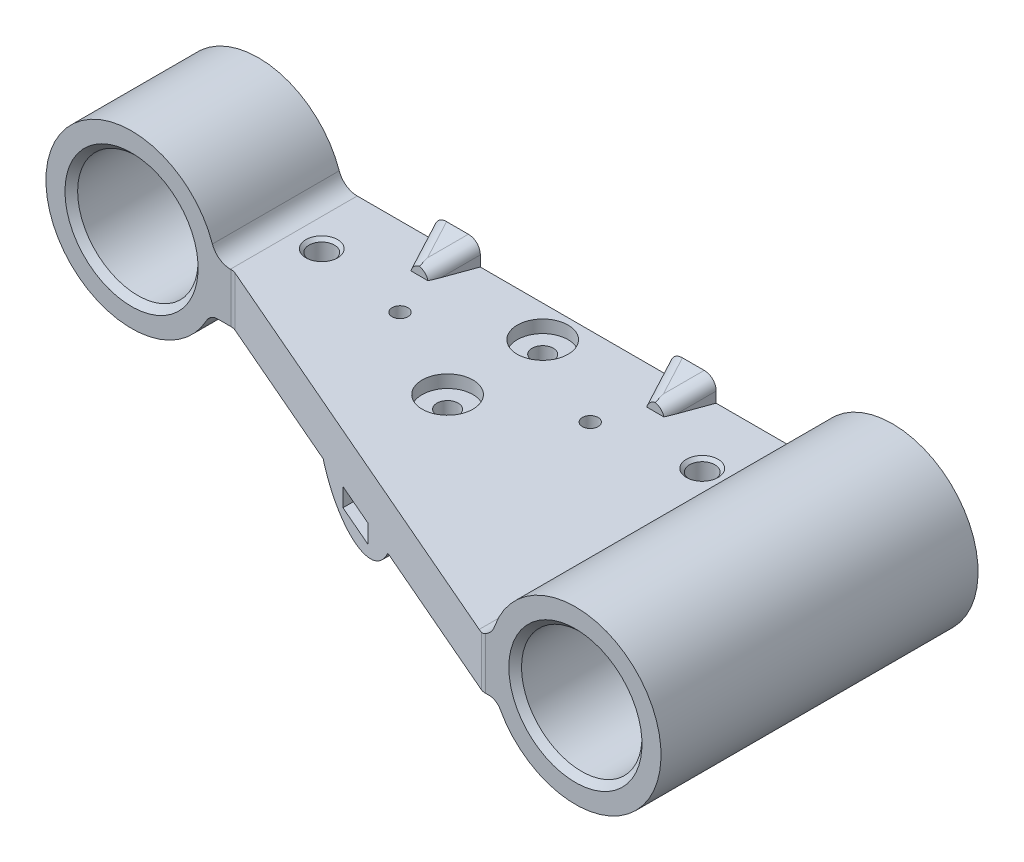
from build123d import *

# Parameters (mm, degrees)
SKETCH1_R                     = 9.5
SKETCH1_W                     = 7
SKETCH1_H                     = 1.9
BOSS_EXTRUDE1_DEPTH           = 50
SKETCH32_W                    = 32.172664372
SKETCH32_H                    = 50
SKETCH32_W_2                  = 30.763378825
BOSS_EXTRUDE4_DEPTH           = 3
SKETCH30_R                    = 1.675
SKETCH30_R_2                  = 1.25
CUT_EXTRUDE14_DEPTH           = 84.200435696
SKETCH31_R                    = 4
CUT_EXTRUDE15_DEPTH           = 2
CHAMFER1_SIZE                 = 1
SKETCH36_R                    = 2
CUT_EXTRUDE18_DEPTH           = 83.371475645
SKETCH37_R                    = 4
CUT_EXTRUDE19_DEPTH           = 2.8
SKETCH38_W                    = 7.194206864
SKETCH38_H                    = 7.080700956
BOSS_EXTRUDE6_DEPTH           = 6
BOSS_EXTRUDE6_DRAFT           = 20
BOSS_EXTRUDE6_PROFILE_2_DEPTH = 6
BOSS_EXTRUDE6_PROFILE_2_DRAFT = 20
FILLET2_R                     = 2
CHAMFER2_SIZE                 = 0.5
CUT_EXTRUDE20_START           = -10
SKETCH39_W                    = 33.713665857
SKETCH39_H                    = 35.884460507
CUT_EXTRUDE20_DEPTH           = 67.252868798
CUT_EXTRUDE21_DEPTH           = 83.371475645
CUT_EXTRUDE21_DEPTH_BACK      = 83.371475645
CHAMFER3_SIZE                 = 1
FILLET3_R                     = 2


with BuildPart() as part:
    # Sketch1 → Boss-Extrude1 (new body)
    with BuildSketch(Plane.XY):
        with BuildLine():
            Line((-34.408656248, 2.4), (34.408656248, 2.4))
            ThreePointArc((34.408656248, 2.4), (36.148562201, 2.95608362), (37.243446021, 4.418181818))
            ThreePointArc((37.243446021, 4.418181818), (52.24014746, 13.312841145), (63.5, 0))
            ThreePointArc((63.5, 0), (59.545941546, -9.545941546), (50, -13.5))
            ThreePointArc((50, -13.5), (42.170423209, -10.99762371), (37.243446021, -4.418181818))
            ThreePointArc((37.243446021, -4.418181818), (36.148562201, -2.95608362), (34.408656248, -2.4))
            Line((34.408656248, -2.4), (12.372954376, -2.4))
            ThreePointArc((12.372954376, -2.4), (10.729786704, -2.89001992), (9.623408959, -4.2))
            ThreePointArc((9.623408959, -4.2), (0, -10.5), (-9.623408959, -4.2))
            ThreePointArc((-9.623408959, -4.2), (-10.729786704, -2.89001992), (-12.372954376, -2.4))
            Line((-12.372954376, -2.4), (-34.408656248, -2.4))
            ThreePointArc((-34.408656248, -2.4), (-36.148562201, -2.95608362), (-37.243446021, -4.418181818))
            ThreePointArc((-37.243446021, -4.418181818), (-42.170423209, -10.99762371), (-50, -13.5))
            ThreePointArc((-50, -13.5), (-59.545941546, -9.545941546), (-63.5, 0))
            ThreePointArc((-63.5, 0), (-52.24014746, 13.312841145), (-37.243446021, 4.418181818))
            ThreePointArc((-37.243446021, 4.418181818), (-36.148562201, 2.95608362), (-34.408656248, 2.4))
        make_face()
        with Locations((50, 0)):
            Circle(SKETCH1_R, mode=Mode.SUBTRACT)
        with Locations(Location((-50, 0, 0), (0, 0, 180))):
            Circle(SKETCH1_R, mode=Mode.SUBTRACT)
        with Locations((0, -7.2)):
            Rectangle(SKETCH1_W, SKETCH1_H, mode=Mode.SUBTRACT)
    extrude(amount=BOSS_EXTRUDE1_DEPTH)

    # Sketch32 → Boss-Extrude4 (add)
    with BuildSketch(Plane.XZ.offset(2.4)):
        with Locations((-22.574766715, 25)):
            Rectangle(SKETCH32_W, SKETCH32_H)
        with Locations((23.370404996, 25)):
            Rectangle(SKETCH32_W_2, SKETCH32_H)
    extrude(amount=BOSS_EXTRUDE4_DEPTH)

    # Sketch30 → Cut-Extrude14 (cut, through all)
    with BuildSketch(Plane(origin=(0, -6.25, 0), x_dir=(1, 0, 0), z_dir=(0, 1, 0))):
        with Locations(Location((-0.160776584, -5, 0), (0, 0, 90))):
            Circle(SKETCH30_R)
        with Locations(Location((-0.160776584, -20, 0), (0, 0, 90))):
            Circle(SKETCH30_R)
        with Locations(Location((14.839223416, -12.5, 0), (0, 0, 90))):
            Circle(SKETCH30_R_2)
        with Locations(Location((-15.160776584, -12.5, 0), (0, 0, 90))):
            Circle(SKETCH30_R_2)
    extrude(amount=CUT_EXTRUDE14_DEPTH, mode=Mode.SUBTRACT)

    # Sketch31 → Cut-Extrude15 (cut)
    with BuildSketch(Plane(origin=(0, 2.4, 0), x_dir=(1, 0, 0), z_dir=(0, 1, 0))):
        with Locations(Location((-0.160776584, -5, 0), (0, 0, 270))):
            Circle(SKETCH31_R)
        with Locations(Location((-0.160776584, -20, 0), (0, 0, 270))):
            Circle(SKETCH31_R)
    extrude(amount=-CUT_EXTRUDE15_DEPTH, mode=Mode.SUBTRACT)

    # Chamfer1
    chamfer1_edges = [part.edges().sort_by_distance(p)[0] for p in [
        (0, -6.25, 0),
        (0, -6.25, 50),
    ]]
    chamfer(chamfer1_edges, length=CHAMFER1_SIZE)

    # Sketch36 → Cut-Extrude18 (cut, through all)
    with BuildSketch(Plane(origin=(0, 2.4, 0), x_dir=(1, 0, 0), z_dir=(0, 1, 0))):
        with Locations(Location((30, -10, 0), (0, 0, 270))):
            Circle(SKETCH36_R)
        with Locations(Location((-30, -10, 0), (0, 0, 270))):
            Circle(SKETCH36_R)
    extrude(amount=-CUT_EXTRUDE18_DEPTH, mode=Mode.SUBTRACT)

    # Sketch37 → Cut-Extrude19 (cut)
    with BuildSketch(Plane.XZ.offset(5.4)):
        with Locations((30, 10)):
            Circle(SKETCH37_R)
        with Locations((-30, 10)):
            Circle(SKETCH37_R)
    extrude(amount=-CUT_EXTRUDE19_DEPTH, mode=Mode.SUBTRACT)


with BuildPart() as boss_extrude6_tool:
    # Sketch38 → Boss-Extrude6 (with draft: the straight prism first)
    with BuildSketch(Plane(origin=(0, 2.4, 0), x_dir=(1, 0, 0), z_dir=(0, 0, 1))):
        with Locations((18.597103432, 0)):
            Rectangle(SKETCH38_W, SKETCH38_H)
    extrude(amount=BOSS_EXTRUDE6_DEPTH)
    # Boss-Extrude6: the draft: its side faces are tilted about the plane it starts from
    boss_extrude6_sides = [boss_extrude6_tool.faces().sort_by_distance(p)[0] for p in [
        (22.194206864, 2.4, 3),
        (18.597103432, 5.940350478, 3),
        (15, 2.4, 3),
        (18.597103432, -1.140350478, 3),
    ]]
    draft(boss_extrude6_sides, Plane(origin=(0, 2.4, 0), x_dir=(1, 0, 0), z_dir=(0, 0, 1)), BOSS_EXTRUDE6_DRAFT)


with BuildPart() as part_1:
    add(part.part)

    # Boss-Extrude6: add boss_extrude6_tool
    add(boss_extrude6_tool.part)


with BuildPart() as boss_extrude6_profile_2_tool:
    # Sketch38 → Boss-Extrude6 profile 2 (with draft: the straight prism first)
    with BuildSketch(Plane(origin=(0, 2.4, 0), x_dir=(1, 0, 0), z_dir=(0, 0, 1))):
        with Locations((-18.597103432, 0)):
            Rectangle(SKETCH38_W, SKETCH38_H)
    extrude(amount=BOSS_EXTRUDE6_PROFILE_2_DEPTH)
    # Boss-Extrude6 profile 2: the draft: its side faces are tilted about the plane it starts from
    boss_extrude6_profile_2_sides = [boss_extrude6_profile_2_tool.faces().sort_by_distance(p)[0] for p in [
        (-15, 2.4, 3),
        (-18.597103432, 5.940350478, 3),
        (-22.194206864, 2.4, 3),
        (-18.597103432, -1.140350478, 3),
    ]]
    draft(boss_extrude6_profile_2_sides, Plane(origin=(0, 2.4, 0), x_dir=(1, 0, 0), z_dir=(0, 0, 1)), BOSS_EXTRUDE6_PROFILE_2_DRAFT)


with BuildPart() as part_2:
    add(part_1.part)

    # Boss-Extrude6 profile 2: add boss_extrude6_profile_2_tool
    add(boss_extrude6_profile_2_tool.part)

    # Fillet2
    # the kernel refuses this fillet: 2 mm, written as the material it takes off along each edge
    with BuildSketch(Plane(origin=(23.632882776, 7.37902639, -3.952729582), x_dir=(0.11068304606838114, -0.946188648339465, -0.30409916978933155), z_dir=(-0.32361557711818506, -0.3236155771181852, 0.8891264907159881))) as fillet2_piece_1_section:
        with BuildLine():
            CenterArc((FILLET2_R * 0.889126490716, -FILLET2_R), FILLET2_R, 90, 83.282286536)
            Line((-FILLET2_R * 0.104008041637, -FILLET2_R * 0.883022221559), (0, 0))
            Line((0, 0), (FILLET2_R * 0.889126490716, 0))
        make_face()
    fillet2_piece_1 = extrude(amount=15.6394611, mode=Mode.PRIVATE)
    fillet2_piece_1 = split(fillet2_piece_1, bisect_by=Plane(origin=(20.940546386, 2.4, 2.229867585), z_dir=(0, 1, 0)), keep=Keep.TOP, mode=Mode.PRIVATE)
    add(fillet2_piece_1, mode=Mode.SUBTRACT)
    with BuildSketch(Plane(origin=(13.561324088, 7.37902639, -3.952729582), x_dir=(0.9461886483394653, 0.1106830460683812, -0.30409916978933144), z_dir=(0.3236155771181851, -0.32361557711818495, 0.8891264907159883))) as fillet2_piece_2_section:
        with BuildLine():
            CenterArc((FILLET2_R * 0.889126490716, -FILLET2_R), FILLET2_R, 90, 83.282286536)
            Line((-FILLET2_R * 0.104008041637, -FILLET2_R * 0.883022221559), (0, 0))
            Line((0, 0), (FILLET2_R * 0.889126490716, 0))
        make_face()
    fillet2_piece_2 = extrude(amount=15.6394611, mode=Mode.PRIVATE)
    fillet2_piece_2 = split(fillet2_piece_2, bisect_by=Plane(origin=(16.253660478, 2.4, 2.229867585), z_dir=(0, 1, 0)), keep=Keep.TOP, mode=Mode.PRIVATE)
    add(fillet2_piece_2, mode=Mode.SUBTRACT)
    with BuildSketch(Plane(origin=(-23.632882776, 7.37902639, -3.952729582), x_dir=(-0.11068304606838135, -0.9461886483394651, -0.3040991697893313), z_dir=(0.32361557711818506, -0.3236155771181851, 0.8891264907159881))) as fillet2_piece_3_section:
        with BuildLine():
            CenterArc((FILLET2_R * 0.889126490716, FILLET2_R), FILLET2_R, 186.717713464, 83.282286536)
            Line((-FILLET2_R * 0.104008041637, FILLET2_R * 0.883022221559), (0, 0))
            Line((0, 0), (FILLET2_R * 0.889126490716, 0))
        make_face()
    fillet2_piece_3 = extrude(amount=15.6394611, mode=Mode.PRIVATE)
    fillet2_piece_3 = split(fillet2_piece_3, bisect_by=Plane(origin=(-20.940546386, 2.4, 2.229867585), z_dir=(0, 1, 0)), keep=Keep.TOP, mode=Mode.PRIVATE)
    add(fillet2_piece_3, mode=Mode.SUBTRACT)
    with BuildSketch(Plane(origin=(-13.561324088, 7.37902639, -3.952729582), x_dir=(0.11068304606838107, -0.9461886483394651, -0.3040991697893313), z_dir=(-0.32361557711818506, -0.323615577118185, 0.8891264907159881))) as fillet2_piece_4_section:
        with BuildLine():
            CenterArc((FILLET2_R * 0.889126490716, -FILLET2_R), FILLET2_R, 90, 83.282286536)
            Line((-FILLET2_R * 0.104008041637, -FILLET2_R * 0.883022221559), (0, 0))
            Line((0, 0), (FILLET2_R * 0.889126490716, 0))
        make_face()
    fillet2_piece_4 = extrude(amount=15.6394611, mode=Mode.PRIVATE)
    fillet2_piece_4 = split(fillet2_piece_4, bisect_by=Plane(origin=(-16.253660478, 2.4, 2.229867585), z_dir=(0, 1, 0)), keep=Keep.TOP, mode=Mode.PRIVATE)
    add(fillet2_piece_4, mode=Mode.SUBTRACT)

    # Chamfer2
    chamfer2_edges = [part_2.edges().sort_by_distance(p)[0] for p in [
        (30, 2.4, 8),
        (-30, 2.4, 8),
    ]]
    chamfer(chamfer2_edges, length=CHAMFER2_SIZE)

    # Sketch39 → Cut-Extrude20 (cut, through all)
    with BuildSketch(Plane(origin=(0, 0, 10), x_dir=(-1, 0, 0), z_dir=(0, 0, -1)).offset(CUT_EXTRUDE20_START)):
        with Locations((50.736194558, -0.327009614)):
            Rectangle(SKETCH39_W, SKETCH39_H)
    extrude(amount=-CUT_EXTRUDE20_DEPTH, mode=Mode.SUBTRACT)

    # Sketch40 → Cut-Extrude21 (cut, two sides: drawn at the far end of the back side and taken through both)
    with BuildSketch(Plane(origin=(0, 2.4, 0), x_dir=(1, 0, 0), z_dir=(0, 1, 0)).offset(-CUT_EXTRUDE21_DEPTH_BACK)):
        Polygon((-33.879361629, -20), (95.398235412, -76.00132788), (-43.756067754, -79.660476008), align=None)
    extrude(amount=CUT_EXTRUDE21_DEPTH + CUT_EXTRUDE21_DEPTH_BACK, mode=Mode.SUBTRACT)

    # Chamfer3
    chamfer3_edges = [part_2.edges().sort_by_distance(p)[0] for p in [
        (-40.5, 0, 20),
        (0, -6.25, 34.676086827),
        (40.5, 0, 0),
        (40.5, 0, 50),
        (-40.5, 0, 0),
    ]]
    chamfer(chamfer3_edges, length=CHAMFER3_SIZE)

    # Fillet3
    fillet3_edges = [part_2.edges().sort_by_distance(p)[0] for p in [
        (-33.879361629, -1.5, 20),
        (35.374851763, -1.42007625, 50),
        (-37.627045624, -5.4, 10),
        (37.627045624, -5.4, 25),
    ]]
    fillet(fillet3_edges, radius=FILLET3_R)


solid = part_2.part
